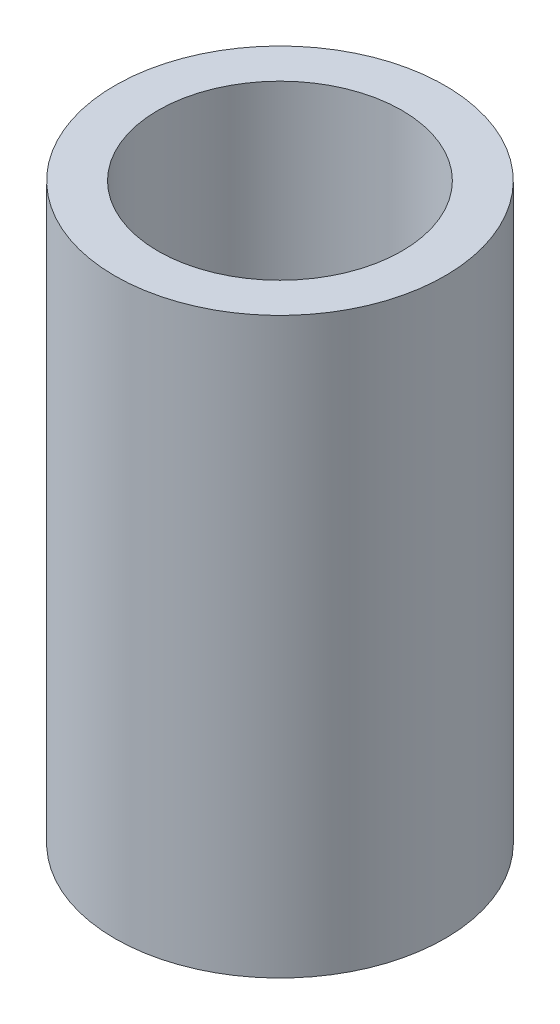
from build123d import *

# Parameters (mm, degrees)
SKETCH1_R           = 5.75
SKETCH1_R_2         = 4.25
BOSS_EXTRUDE1_DEPTH = 20


with BuildPart() as part:
    # Sketch1 → Boss-Extrude1 (new body)
    with BuildSketch(Plane(origin=(0, 0, 0), x_dir=(1, 0, 0), z_dir=(0, 1, 0))):
        Circle(SKETCH1_R)
        Circle(SKETCH1_R_2, mode=Mode.SUBTRACT)
    extrude(amount=BOSS_EXTRUDE1_DEPTH)


solid = part.part
